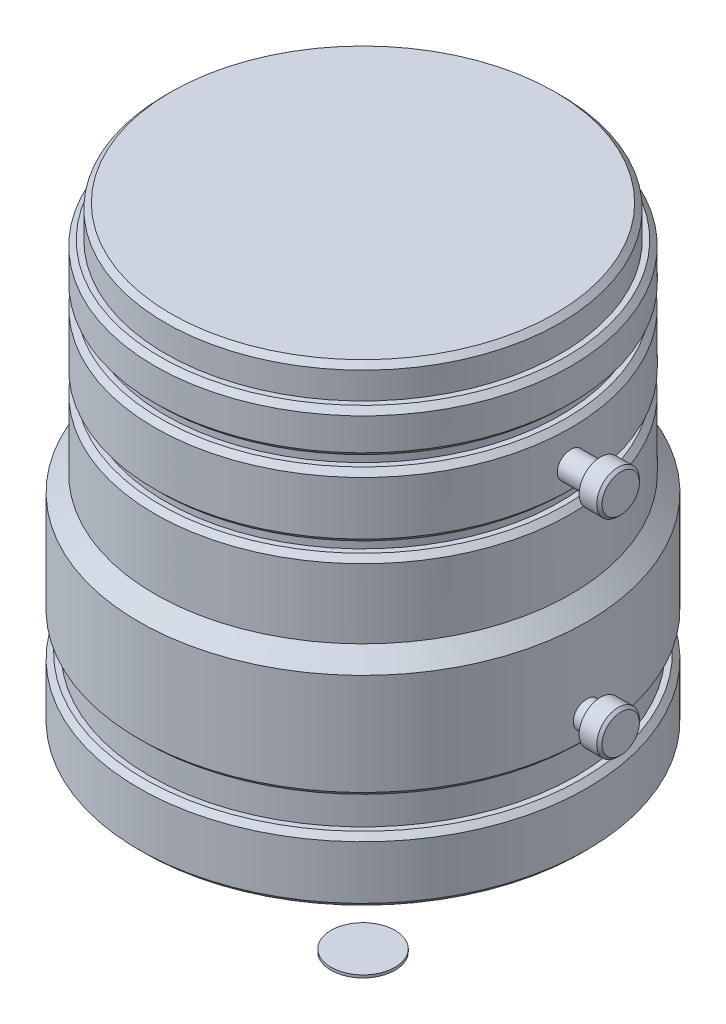
from build123d import *

# Parameters (mm, degrees)
F_5MM_BODY_CHAMFERS_SIZE           = 0.5
F_1_5MM_BODY_CHAMFERS_SIZE         = 1.5
F_48MM_X_28MM_BODY_CHAMFER_1_SIZE  = 0.28
F_48MM_X_28MM_BODY_CHAMFER_1_SIZE2 = 0.48
F_48MM_X_28MM_BODY_CHAMFER_2_SIZE  = 0.48
F_48MM_X_28MM_BODY_CHAMFER_2_SIZE2 = 0.28
SKETCH2_R                          = 9
SENSOR_HOLE_DEPTH                  = 10
F_25MM_UPPER_KNOB_CHAMFER_SIZE     = 0.25
F_25MM_LOWER_KNOB_CHAMFER_SIZE     = 0.25
SKETCH9_R                          = 3
FOCAL_POINT_DEPTH                  = 0.25


with BuildPart() as part:
    # Sketch1 → Lens Body (revolve)
    with BuildSketch(Plane.XY, mode=Mode.PRIVATE) as lens_body_sk:
        Polygon((0, 0), (18.5, 0), (18.5, -3), (19.5, -3), (19.5, -7), (18.5, -7), (18.5, -8), (19.5, -8), (19.5, -14), (18.5, -14), (18.5, -15), (19.5, -15), (19.5, -22), (21, -22), (21, -33.5), (20, -33.5), (20, -36.5), (21, -36.5), (21, -42.5), (18, -42.5), (18, -43), (12.18, -43), (12.18, -43.75), (12.7, -43.75), (12.7, -47), (0, -47), align=None)
    revolve(lens_body_sk.sketch.rotate(Axis((0, 0, 0), (0, -1, 0)), 180), axis=Axis((0, 0, 0), (0, -1, 0)))

    # .5mm Body Chamfers
    f_5mm_body_chamfers_edges = [part.edges().sort_by_distance(p)[0] for p in [
        (18, -43, 0),
        (21, -42.5, 0),
        (21, -36.5, 0),
        (21, -33.5, 0),
        (19.5, -15, 0),
        (19.5, -14, 0),
        (19.5, -8, 0),
        (19.5, -7, 0),
        (19.5, -3, 0),
        (18.5, 0, 0),
    ]]
    chamfer(f_5mm_body_chamfers_edges, length=F_5MM_BODY_CHAMFERS_SIZE - 0.0001)  # a hair under: the kernel refuses the full size

    # 1.5mm Body Chamfers
    f_1_5mm_body_chamfers_edges = [part.edges().sort_by_distance(p)[0] for p in [
        (21, -22, 0),
    ]]
    chamfer(f_1_5mm_body_chamfers_edges, length=F_1_5MM_BODY_CHAMFERS_SIZE - 0.0001)  # a hair under: the kernel refuses the full size

    # .48mm x .28mm Body Chamfer 1
    f_48mm_x_28mm_body_chamfer_1_edges = [part.edges().sort_by_distance(p)[0] for p in [
        (12.7, -43.75, 0),
    ]]
    f_48mm_x_28mm_body_chamfer_1_side = [part.faces().sort_by_distance(p)[0] for p in [
        (12.7, -45.375, 0),
    ]]
    chamfer(f_48mm_x_28mm_body_chamfer_1_edges, length=F_48MM_X_28MM_BODY_CHAMFER_1_SIZE, length2=F_48MM_X_28MM_BODY_CHAMFER_1_SIZE2, reference=f_48mm_x_28mm_body_chamfer_1_side[0])

    # .48mm x .28mm Body Chamfer 2
    f_48mm_x_28mm_body_chamfer_2_edges = [part.edges().sort_by_distance(p)[0] for p in [
        (12.7, -47, 0),
    ]]
    f_48mm_x_28mm_body_chamfer_2_side = [part.faces().sort_by_distance(p)[0] for p in [
        (0, -47, 0),
    ]]
    chamfer(f_48mm_x_28mm_body_chamfer_2_edges, length=F_48MM_X_28MM_BODY_CHAMFER_2_SIZE, length2=F_48MM_X_28MM_BODY_CHAMFER_2_SIZE2, reference=f_48mm_x_28mm_body_chamfer_2_side[0])

    # Sketch2 → Sensor Hole (cut)
    with BuildSketch(Plane.XZ.offset(47)):
        Circle(SKETCH2_R)
    extrude(amount=-SENSOR_HOLE_DEPTH, mode=Mode.SUBTRACT)


with BuildPart() as body_2:
    # Sketch7 → Lower Knob (revolve)
    with BuildSketch(Plane.XY, mode=Mode.PRIVATE) as lower_knob_sk:
        Polygon((20, -32.25), (22.25, -32.25), (22.25, -33), (24.15, -33), (24.15, -31), (20, -31), align=None)
    revolve(lower_knob_sk.sketch.rotate(Axis((24.15, -31, 0), (-1, 0, 0)), 270), axis=Axis((24.15, -31, 0), (-1, 0, 0)))

    # .25mm Lower Knob Chamfer
    f_25mm_lower_knob_chamfer_edges = [body_2.edges().sort_by_distance(p)[0] for p in [
        (24.15, -31, 2),
    ]]
    chamfer(f_25mm_lower_knob_chamfer_edges, length=F_25MM_LOWER_KNOB_CHAMFER_SIZE)


with BuildPart() as body_3:
    # Sketch8 → Upper Knob (revolve)
    with BuildSketch(Plane.XY, mode=Mode.PRIVATE) as upper_knob_sk:
        Polygon((18.5, -12.75), (22.25, -12.75), (22.25, -13.5), (24.15, -13.5), (24.15, -11.5), (18.5, -11.5), align=None)
    revolve(upper_knob_sk.sketch.rotate(Axis((24.15, -11.5, 0), (-1, 0, 0)), 180), axis=Axis((24.15, -11.5, 0), (-1, 0, 0)))

    # .25mm Upper Knob Chamfer
    f_25mm_upper_knob_chamfer_edges = [body_3.edges().sort_by_distance(p)[0] for p in [
        (24.15, -13.5, 0),
    ]]
    chamfer(f_25mm_upper_knob_chamfer_edges, length=F_25MM_UPPER_KNOB_CHAMFER_SIZE)


with BuildPart() as body_4:
    # Sketch9 → Focal Point (new body)
    with BuildSketch(Plane(origin=(0, -60.78, 0), x_dir=(1, 0, 0), z_dir=(0, 1, 0))):
        with Locations(Location((0, 0, 0), (0, 0, 180))):
            Circle(SKETCH9_R)
    extrude(amount=FOCAL_POINT_DEPTH)


solid = Compound([part.part, body_2.part, body_3.part, body_4.part])
